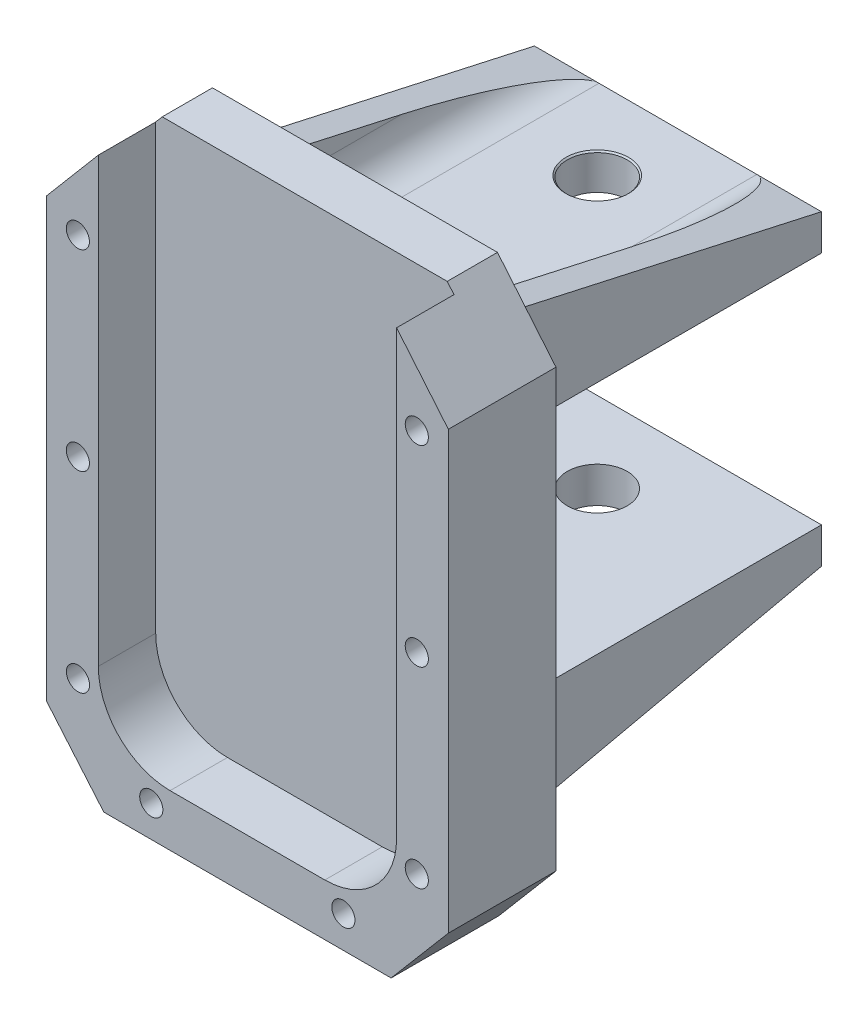
from build123d import *

# Parameters (mm, degrees)
SKETCH1_W                      = 35.56
SKETCH1_H                      = 50.8
BOSS_EXTRUDE1_DEPTH            = 9.525
SKETCH2_W                      = 26.4
SKETCH2_H                      = 46.22
CUT_EXTRUDE2_DEPTH             = 5.08
TAP_DRILL_FOR_M2_5X0_45_TAP1_D = 2.05
SKETCH13_W                     = 25.4
SKETCH13_H                     = 3.175
BOSS_EXTRUDE2_DEPTH            = 28.575
CUT_EXTRUDE3_DEPTH             = 73.778867812
FILLET1_R                      = 6.35
M5_CLEARANCE_HOLE1_D           = 5.3
M5_CLEARANCE_HOLE1_CSINK_D     = 5.55
M5_CLEARANCE_HOLE1_CSINK_ANGLE = 90
RIB7_REACH                     = 67.774
SKETCH14_WALL_W                = 162.819779212
SKETCH14_WALL_H                = 2.54
RIB8_REACH                     = 67.774
SKETCH15_WALL_W                = 162.819779212
SKETCH15_WALL_H                = 2.54
RIB9_REACH                     = 67.774
SKETCH17_WALL_W                = 162.819779212
SKETCH17_WALL_H                = 2.54
RIB10_REACH                    = 67.774
SKETCH16_WALL_W                = 162.819779212
SKETCH16_WALL_H                = 2.54
FILLET2_R                      = 3.175
FILLET3_R                      = 3.175


with BuildPart() as part:
    # Sketch1 → Boss-Extrude1 (new body)
    with BuildSketch(Plane.XY):
        with Locations((-17.78, 25.4)):
            Rectangle(SKETCH1_W, SKETCH1_H)
    extrude(amount=BOSS_EXTRUDE1_DEPTH)

    # Sketch2 → Cut-Extrude2 (cut)
    with BuildSketch(Plane.XY.offset(9.525)):
        with Locations((-17.78, 27.69)):
            Rectangle(SKETCH2_W, SKETCH2_H)
    extrude(amount=-CUT_EXTRUDE2_DEPTH, mode=Mode.SUBTRACT)

    # Tap Drill for M2.5x0.45 Tap1 (through all)
    with Locations(Plane(origin=(0, 0, 0), x_dir=(-1, 0, 0), z_dir=(0, 0, -1))):
        with Locations((2.792369004, 43.087106138), (2.792369004, 26.092979092), (2.792369004, 9.105182099), (9.290740849, 2.822744672), (26.292369004, 2.787106138), (32.780032006, 9.105182099), (32.792369004, 26.087106138), (32.792369004, 43.087106138)):
            Hole(TAP_DRILL_FOR_M2_5X0_45_TAP1_D / 2)

    # Sketch13 → Boss-Extrude2 (add)
    with BuildSketch(Plane(origin=(0, 0, 0), x_dir=(-1, 0, 0), z_dir=(0, 0, -1))):
        with Locations((17.78, 38.091545037)):
            Rectangle(SKETCH13_W, SKETCH13_H)
        with Locations((17.78, 14.088545037)):
            Rectangle(SKETCH13_W, SKETCH13_H)
    extrude(amount=BOSS_EXTRUDE2_DEPTH)

    # Sketch8 → Cut-Extrude3 (cut, through all)
    with BuildSketch(Plane.XY.offset(9.525)):
        Polygon((-5.178964387, 50.8), (0, 44.591495864), (0, 50.8), align=None)
        Polygon((-35.56, 44.706622517), (-35.56, 50.8), (-30.402645731, 50.8), align=None)
        Polygon((-35.56, 5.970049098), (-35.56, 0), (-30.492594088, 0), align=None)
        Polygon((-5.092594088, -0.031324356), (0, 0), (0, 5.970049098), align=None)
    extrude(amount=-CUT_EXTRUDE3_DEPTH, mode=Mode.SUBTRACT)

    # Fillet1
    fillet1_edges = [part.edges().sort_by_distance(p)[0] for p in [
        (-4.58, 4.58, 6.985),
        (-30.98, 4.58, 6.985),
    ]]
    fillet(fillet1_edges, radius=FILLET1_R)

    # M5 Clearance Hole1 (through all)
    with Locations(Plane(origin=(-17.78, 39.679045037, -7.14375), x_dir=(0, 0, 1), z_dir=(0, 1, 0))):
        with Locations((0, 0), (-14.2875, 0)):
            CounterSinkHole(M5_CLEARANCE_HOLE1_D / 2, M5_CLEARANCE_HOLE1_CSINK_D / 2, counter_sink_angle=M5_CLEARANCE_HOLE1_CSINK_ANGLE)

    # Sketch14 wall → Rib7 (add, up to next)
    with BuildSketch(Plane(origin=(-30.48, 9.326045037, -14.2875), x_dir=(0, -0.216930457819, 0.976187060184), z_dir=(0, 0.976187060184, 0.216930457819)), mode=Mode.PRIVATE) as rib7_sk1:
        with Locations((0, 1.27)):
            Rectangle(SKETCH14_WALL_W, SKETCH14_WALL_H)
    rib7_tool1 = extrude(rib7_sk1.sketch, amount=RIB7_REACH, mode=Mode.PRIVATE) - part.part
    add(rib7_tool1.solids().sort_by_distance((-30.48, 9.326045037, -14.2875))[0])

    # Sketch15 wall → Rib8 (add, up to next)
    with BuildSketch(Plane(origin=(-5.08, 9.326045037, -14.2875), x_dir=(0, -0.216930457819, 0.976187060184), z_dir=(0, -0.976187060184, -0.216930457819)), mode=Mode.PRIVATE) as rib8_sk1:
        with Locations((0, 1.27)):
            Rectangle(SKETCH15_WALL_W, SKETCH15_WALL_H)
    rib8_tool1 = extrude(rib8_sk1.sketch, amount=-RIB8_REACH, mode=Mode.PRIVATE) - part.part
    add(rib8_tool1.solids().sort_by_distance((-5.08, 9.326045037, -14.2875))[0])

    # Sketch17 wall → Rib9 (add, up to next)
    with BuildSketch(Plane(origin=(-5.08, 42.854045037, -14.2875), x_dir=(0, 0.216930457819, 0.976187060184), z_dir=(0, -0.976187060184, 0.216930457819)), mode=Mode.PRIVATE) as rib9_sk1:
        with Locations((0, 1.27)):
            Rectangle(SKETCH17_WALL_W, SKETCH17_WALL_H)
    rib9_tool1 = extrude(rib9_sk1.sketch, amount=RIB9_REACH, mode=Mode.PRIVATE) - part.part
    add(rib9_tool1.solids().sort_by_distance((-5.08, 42.854045037, -14.2875))[0])

    # Sketch16 wall → Rib10 (add, up to next)
    with BuildSketch(Plane(origin=(-30.48, 42.854045037, -14.2875), x_dir=(0, 0.216930457819, 0.976187060184), z_dir=(0, 0.976187060184, -0.216930457819)), mode=Mode.PRIVATE) as rib10_sk1:
        with Locations((0, 1.27)):
            Rectangle(SKETCH16_WALL_W, SKETCH16_WALL_H)
    rib10_tool1 = extrude(rib10_sk1.sketch, amount=-RIB10_REACH, mode=Mode.PRIVATE) - part.part
    add(rib10_tool1.solids().sort_by_distance((-30.48, 42.854045037, -14.2875))[0])

    # Fillet2
    fillet2_edges = [part.edges().sort_by_distance(p)[0] for p in [
        (-27.94, 12.501045037, -14.2875),
        (-7.62, 12.501045037, -14.2875),
    ]]
    fillet(fillet2_edges, radius=FILLET2_R)

    # Fillet3
    fillet3_edges = [part.edges().sort_by_distance(p)[0] for p in [
        (-7.62, 39.679045037, -14.2875),
        (-27.94, 39.679045037, -14.2875),
    ]]
    fillet(fillet3_edges, radius=FILLET3_R)


solid = part.part
